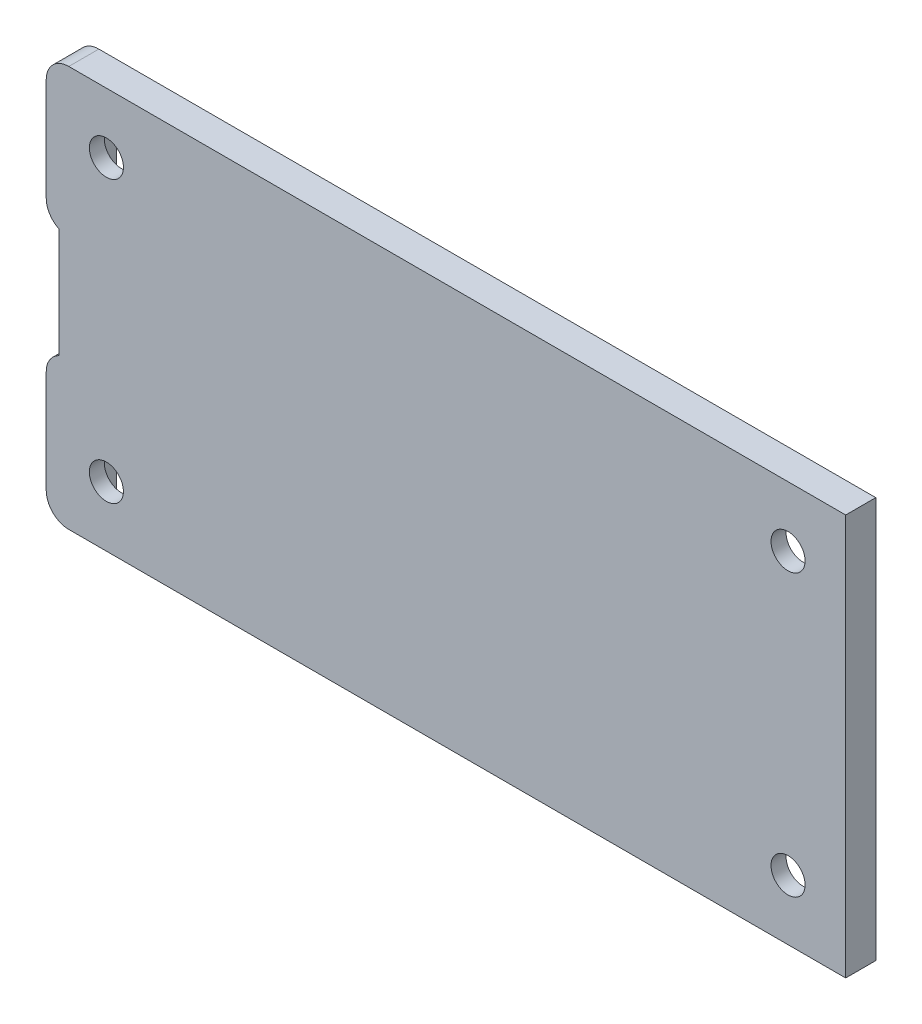
from build123d import *

# Parameters (mm, degrees)
SKETCH1_W           = 79.75
SKETCH1_H           = 40
BOSS_EXTRUDE1_DEPTH = 3
SKETCH2_W           = 2.25
SKETCH2_H           = 10.5
CUT_EXTRUDE1_DEPTH  = 90.26960569
FILLET2_R           = 2.25
FILLET1_R           = 2.25
BOSS_EXTRUDE4_DEPTH = 3.7
SKETCH7_W           = 73.5
SKETCH7_H           = 35.5
OLED_RECESS_DEPTH   = 1.5
SKETCH9_R           = 1.7
CUT_EXTRUDE5_DEPTH  = 90.295870565


with BuildPart() as part:
    # Sketch1 → Boss-Extrude1 (new body)
    with BuildSketch(Plane.XY):
        with Locations((39.875, 20)):
            Rectangle(SKETCH1_W, SKETCH1_H)
    extrude(amount=BOSS_EXTRUDE1_DEPTH)

    # Sketch2 → Cut-Extrude1 (cut, through all)
    with BuildSketch(Plane.XY.offset(3)):
        with Locations((1.125, 20)):
            Rectangle(SKETCH2_W, SKETCH2_H)
    extrude(amount=-CUT_EXTRUDE1_DEPTH, mode=Mode.SUBTRACT)

    # Fillet2
    fillet2_edges = [part.edges().sort_by_distance(p)[0] for p in [
        (0, 14.75, 1.5),
        (0, 25.25, 1.5),
    ]]
    fillet(fillet2_edges, radius=FILLET2_R - 0.0001)  # a hair under: the kernel refuses the full size

    # Fillet1
    fillet1_edges = [part.edges().sort_by_distance(p)[0] for p in [
        (0, 40, 1.5),
        (0, 0, 1.5),
    ]]
    fillet(fillet1_edges, radius=FILLET1_R)

    # Sketch6 → Boss-Extrude4 (add)
    with BuildSketch(Plane.XY.offset(3)):
        with BuildLine():
            Line((1.25, 25.484435563), (1.25, 14.515564437))
            ThreePointArc((1.25, 14.515564437), (1.736443763, 14.69060722), (2.25, 14.75))
            Line((2.25, 14.75), (2.25, 25.25))
            ThreePointArc((2.25, 25.25), (1.736443763, 25.30939278), (1.25, 25.484435563))
        make_face()
    extrude(amount=-BOSS_EXTRUDE4_DEPTH)

    # Sketch7 → oled-recess (cut)
    with BuildSketch(Plane(origin=(0, 0, 0), x_dir=(-1, 0, 0), z_dir=(0, 0, -1))):
        with Locations((-40.75, 20)):
            Rectangle(SKETCH7_W, SKETCH7_H)
    extrude(amount=-OLED_RECESS_DEPTH, mode=Mode.SUBTRACT)

    # Sketch9 → Cut-Extrude5 (cut, through all)
    with BuildSketch(Plane.XY.offset(3)):
        with Locations((6, 34)):
            Circle(SKETCH9_R)
        with Locations((74, 34)):
            Circle(SKETCH9_R)
        with Locations((6, 6)):
            Circle(SKETCH9_R)
        with Locations((74, 6)):
            Circle(SKETCH9_R)
    extrude(amount=-CUT_EXTRUDE5_DEPTH, mode=Mode.SUBTRACT)


solid = part.part
